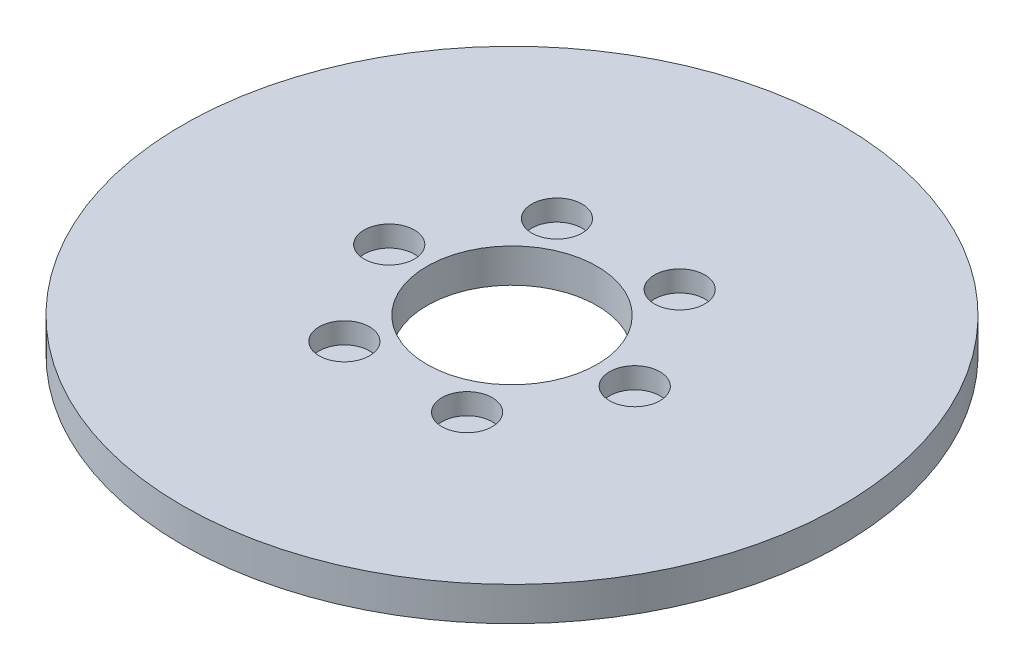
from build123d import *

# Parameters (mm, degrees)
SKETCH1_R           = 77.5
BOSS_EXTRUDE1_DEPTH = 8
SKETCH2_R           = 20
CUT_EXTRUDE1_DEPTH  = 110.893129904
SKETCH3_R           = 5.922396099
CUT_EXTRUDE2_DEPTH  = 4.916962148
CIRPATTERN1_COUNT   = 6


with BuildPart() as part:
    # Sketch1 → Boss-Extrude1 (new body)
    with BuildSketch(Plane(origin=(0, 0, 0), x_dir=(1, 0, 0), z_dir=(0, 1, 0))):
        Circle(SKETCH1_R)
    extrude(amount=BOSS_EXTRUDE1_DEPTH)

    # Sketch2 → Cut-Extrude1 (cut, through all)
    with BuildSketch(Plane(origin=(0, 0, 0), x_dir=(1, 0, 0), z_dir=(0, 1, 0))):
        Circle(SKETCH2_R)
    extrude(amount=CUT_EXTRUDE1_DEPTH, mode=Mode.SUBTRACT)

    # Sketch3 → Cut-Extrude2 (cut)
    with BuildSketch(Plane(origin=(0, 8, 0), x_dir=(1, 0, 0), z_dir=(0, 1, 0))):
        with Locations((-28.864091446, 0)):
            Circle(SKETCH3_R)
    cut_extrude2 = extrude(amount=-CUT_EXTRUDE2_DEPTH, mode=Mode.SUBTRACT)

    # CirPattern1: Cut-Extrude2 ×6 about axis
    cirpattern1_axis = Axis((0, 0, 0), (0, 1, 0))
    for i in range(1, CIRPATTERN1_COUNT):
        add(cut_extrude2.rotate(cirpattern1_axis, i * 360 / CIRPATTERN1_COUNT), mode=Mode.SUBTRACT)


solid = part.part
